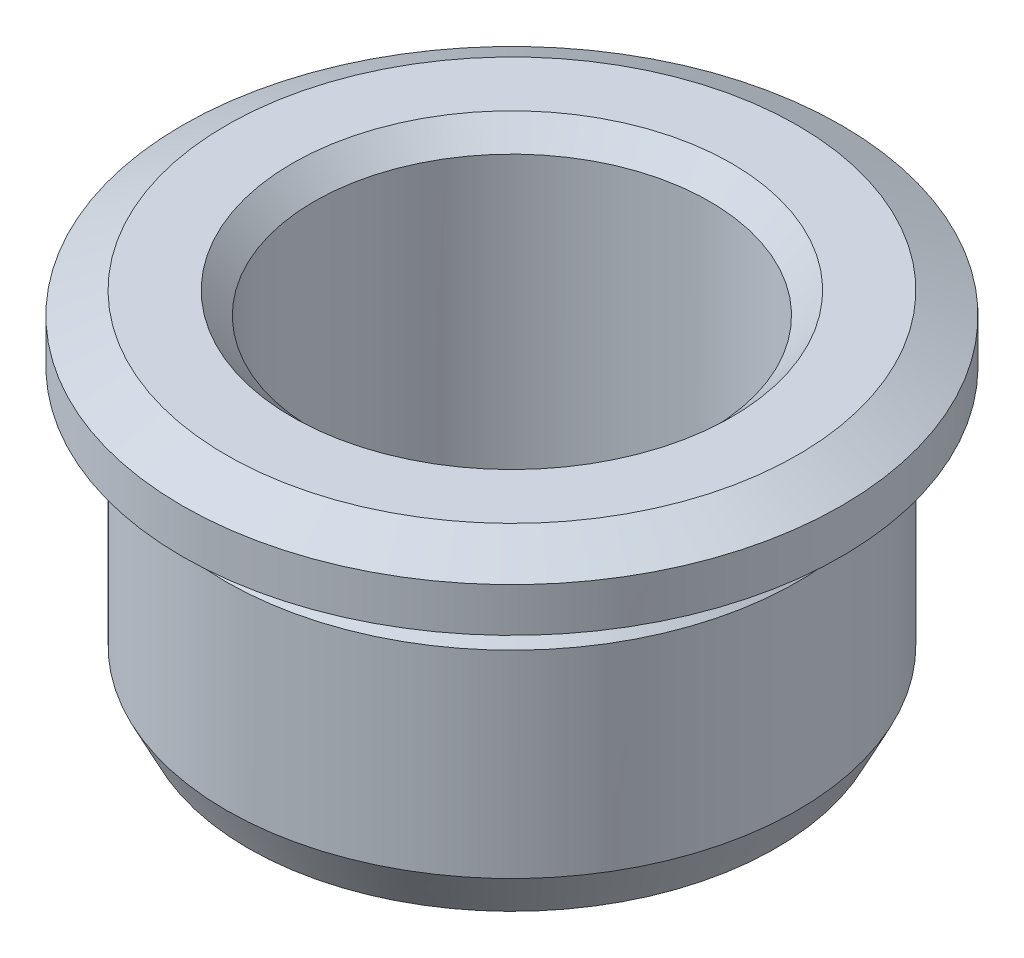
from build123d import *
from OCP.BRepFilletAPI import BRepFilletAPI_MakeChamfer

# Parameters (mm, degrees)
SKETCH_2_R          = 9
CUT_EXTRUDE_1_DEPTH = 27.570660511
CHAMFER_1_SIZE      = 1
CHAMFER_1_SIZE2     = 2
CHAMFER_2_SIZE      = 1


with BuildPart() as part:
    # 草图1 → 旋转1 (revolve)
    with BuildSketch(Plane.XY, mode=Mode.PRIVATE) as revolve_1_sk:
        Polygon((0, 0), (13, 0), (13, 12), (12, 12), (12, 13), (15, 13), (15, 16), (0, 16), align=None)
    revolve(revolve_1_sk.sketch.rotate(Axis((0, 16, 0), (0, -1, 0)), 90), axis=Axis((0, 16, 0), (0, -1, 0)))

    # 草图2 → 切除-拉伸1 (cut, through all)
    with BuildSketch(Plane(origin=(0, 16, 0), x_dir=(1, 0, 0), z_dir=(0, 1, 0))):
        with Locations(Location((0, 0, 0), (0, 0, 180))):
            Circle(SKETCH_2_R)
    extrude(amount=-CUT_EXTRUDE_1_DEPTH, mode=Mode.SUBTRACT)

    # 倒角1: one chamfer whose edges measure the first distance from different faces: ONE call of the kernel's chamfer builder (chamfer() names one face for all edges)
    chamfer_1_edges_1 = [part.edges().sort_by_distance(p)[0] for p in [
        (0, 16, -15),
    ]]
    chamfer_1_side_1 = [part.faces().sort_by_distance(p)[0] for p in [
        (0, 14.5, -15),
    ]]
    chamfer_1_edges_2 = [part.edges().sort_by_distance(p)[0] for p in [
        (0, 0, -13),
    ]]
    chamfer_1_side_2 = [part.faces().sort_by_distance(p)[0] for p in [
        (0, 0, -12.632304474),
    ]]
    chamfer_1 = BRepFilletAPI_MakeChamfer(part.part.solid().wrapped)
    for e in chamfer_1_edges_1:
        chamfer_1.Add(CHAMFER_1_SIZE, CHAMFER_1_SIZE2, e.wrapped, chamfer_1_side_1[0].wrapped)  # the first distance lies on this face
    for e in chamfer_1_edges_2:
        chamfer_1.Add(CHAMFER_1_SIZE, CHAMFER_1_SIZE2, e.wrapped, chamfer_1_side_2[0].wrapped)  # the first distance lies on this face
    add(Compound.cast(chamfer_1.Shape()), mode=Mode.REPLACE)

    # 倒角2
    chamfer_2_edges = [part.edges().sort_by_distance(p)[0] for p in [
        (9, 0, 0),
        (9, 16, 0),
        (0, 12, -13),
    ]]
    chamfer(chamfer_2_edges, length=CHAMFER_2_SIZE - 0.0001)  # a hair under: the kernel refuses the full size


solid = part.part
